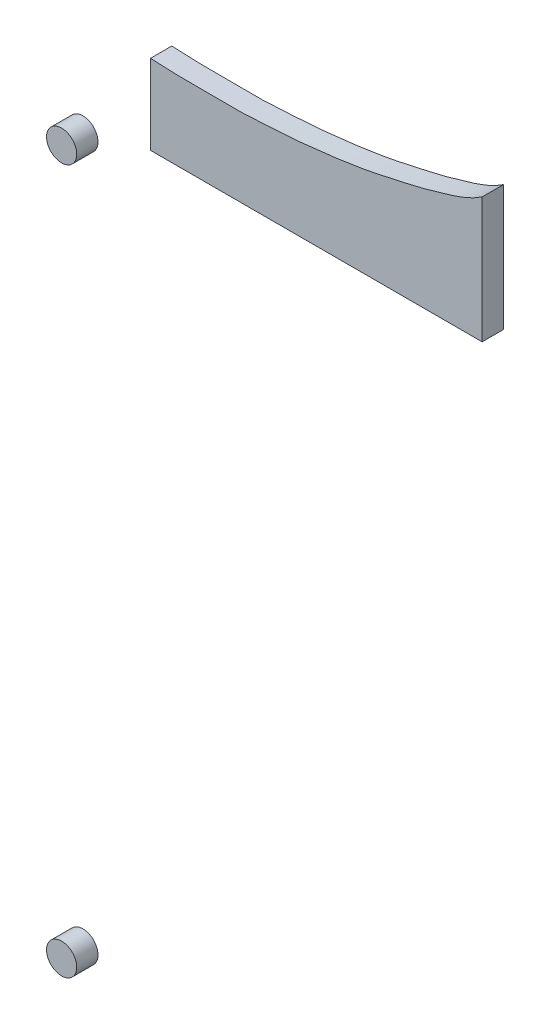
from build123d import *

# Parameters (mm, degrees)
F_3DSKETCH1_R         = 2.25
BOSS_EXTRUDE1_DEPTH   = 3.175
BOSS_EXTRUDE1_2_DEPTH = 3.175
SKETCH1_W             = 3.175
SKETCH1_H             = 22.959761953
BOSS_EXTRUDE2_DEPTH   = 49.462687847
CUT_EXTRUDE1_DEPTH    = 5.08


with BuildPart() as part:
    # 3DSketch1 → Boss-Extrude1 (new body)
    with BuildSketch(Plane(origin=(-464.25, 116.5, 0), x_dir=(-0.27427932364426477, -0.9616500676551969, 0), z_dir=(0, 0, -1))):
        with Locations(Location((108.454058413, -17.154582881, 0), (0, 0, 254.080928829))):
            Circle(F_3DSKETCH1_R)
    extrude(amount=-BOSS_EXTRUDE1_DEPTH)


with BuildPart() as body_2:
    # 3DSketch1 → Boss-Extrude1 2 (new body)
    with BuildSketch(Plane(origin=(-464.25, 116.5, 0), x_dir=(-0.27427932364426477, -0.9616500676551969, 0), z_dir=(0, 0, -1))):
        with Locations(Location((7.480801309, 11.644746102, 0), (0, 0, 254.080928829))):
            Circle(F_3DSKETCH1_R)
    extrude(amount=-BOSS_EXTRUDE1_2_DEPTH)


with BuildPart() as body_3:
    # Sketch1 → Boss-Extrude2 (new body)
    with BuildSketch(Plane(origin=(-464.25, 0, 0), x_dir=(0, 0, -1), z_dir=(1, 0, 0))):
        with Locations((-1.5875, 129.979880976)):
            Rectangle(SKETCH1_W, SKETCH1_H)
    extrude(amount=BOSS_EXTRUDE2_DEPTH)

    # Sketch2 → Cut-Extrude1 (cut)
    with BuildSketch(Plane(origin=(0, 0, 0), x_dir=(-1, 0, 0), z_dir=(0, 0, -1))):
        with BuildLine():
            Line((490, 141.459761953), (414.787312153, 141.459761953))
            Line((414.787312153, 141.459761953), (414.787312153, 137.220888891))
            add(Edge.make_bspline(
                [(414.787312153, 137.220888891), (416.803355128, 135.83988374), (420.148230363, 134.896102648), (424.514399841, 133.641199566), (427.753187268, 132.983461779), (431.906399587, 132.015072768), (436.775926001, 131.291578005), (441.469376717, 130.7599234), (445.244870822, 130.459970277), (448.120397534, 130.350176556), (450.468416009, 130.168574827), (452.276227088, 130.200559294), (453.625826876, 130.185456971), (455.28575693, 130.205272665), (456.826171615, 130.20552598), (458.293104177, 130.205053692), (468.73850206, 130.269698355), (478.824094069, 131.831260872), (488.015089833, 135.328425641)],
                knots=[0, 0, 0, 0, 0.097259794, 0.137717888, 0.182659819, 0.22981785, 0.308935289, 0.380085487, 0.419482255, 0.460955678, 0.495635111, 0.513941351, 0.533517447, 0.549827507, 0.580590235, 0.595366858, 0.608725717, 1, 1, 1, 1], degree=3))
            add(Edge.make_bspline(
                [(488.015089833, 135.328425641), (490.915002323, 134.351803739), (493.963481884, 133.638822528), (497.05, 133.883148618)],
                knots=[0, 0, 0, 0, 1, 1, 1, 1], degree=3))
            Line((497.05, 133.883148618), (497.05, 141.459761953))
            Line((497.05, 141.459761953), (490, 141.459761953))
        make_face()
    extrude(amount=-CUT_EXTRUDE1_DEPTH, mode=Mode.SUBTRACT)


solid = Compound([part.part, body_2.part, body_3.part])
